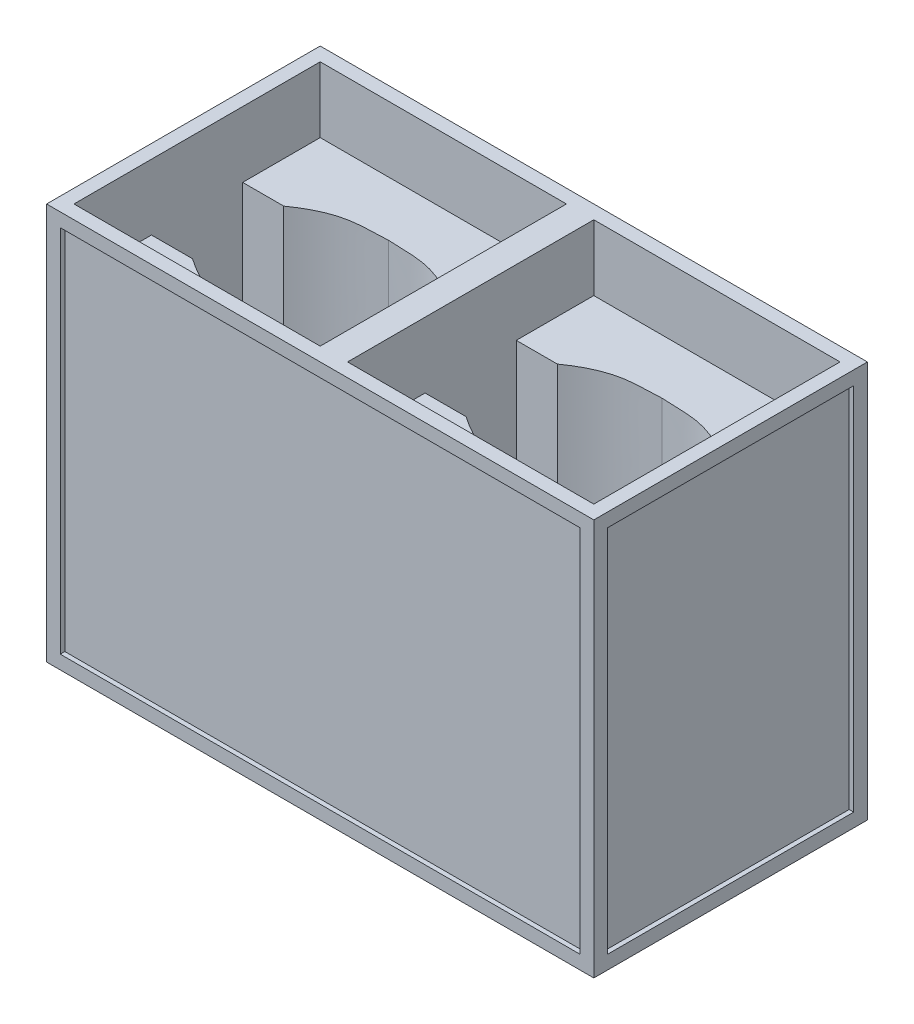
from build123d import *

# Parameters (mm, degrees)
SKETCH1_W           = 120
SKETCH1_H           = 60
BOSS_EXTRUDE1_DEPTH = 87
SKETCH2_W           = 54
SKETCH2_H           = 54
CUT_EXTRUDE1_DEPTH  = 84
BOSS_EXTRUDE2_DEPTH = 69.6
SKETCH6_R           = 5.05
CUT_EXTRUDE2_DEPTH  = 4
SKETCH7_W           = 114
SKETCH7_H           = 81
CUT_EXTRUDE3_DEPTH  = 1
CUT_EXTRUDE4_DEPTH  = 1
SKETCH9_W           = 54
SKETCH9_H           = 81
CUT_EXTRUDE5_DEPTH  = 1
SKETCH10_W          = 54
SKETCH10_H          = 81
CUT_EXTRUDE6_DEPTH  = 1


with BuildPart() as part:
    # Sketch1 → Boss-Extrude1 (new body)
    with BuildSketch(Plane(origin=(0, 0, 0), x_dir=(1, 0, 0), z_dir=(0, 1, 0))):
        with Locations((60, 30)):
            Rectangle(SKETCH1_W, SKETCH1_H)
    extrude(amount=BOSS_EXTRUDE1_DEPTH)

    # Sketch2 → Cut-Extrude1 (cut)
    with BuildSketch(Plane(origin=(0, 87, 0), x_dir=(1, 0, 0), z_dir=(0, 1, 0))):
        with Locations((30, 30)):
            Rectangle(SKETCH2_W, SKETCH2_H)
        with Locations((90, 30)):
            Rectangle(SKETCH2_W, SKETCH2_H)
    extrude(amount=-CUT_EXTRUDE1_DEPTH, mode=Mode.SUBTRACT)

    # Sketch3 → Boss-Extrude2 (add)
    with BuildSketch(Plane(origin=(0, 3, 0), x_dir=(1, 0, 0), z_dir=(0, 1, 0))):
        with BuildLine():
            Line((3, 57), (3, 40))
            Line((3, 40), (12, 40))
            add(Edge.make_bspline(
                [(12, 40), (15.041660356, 42.13868594), (20.58191194, 44.971812716), (26.976295953, 44.853943786), (30, 45)],
                knots=[0.699831651, 0.699831651, 0.699831651, 0.699831651, 1.244465678, 1.699831651, 1.699831651, 1.699831651, 1.699831651], degree=3))
            add(Edge.make_bspline(
                [(30, 45), (33.023704047, 44.853943786), (39.41808806, 44.971812716), (44.958339644, 42.13868594), (48, 40)],
                knots=[0, 0, 0, 0, 0.455365973, 1, 1, 1, 1], degree=3))
            Line((48, 40), (57, 40))
            Line((57, 40), (57, 57))
            Line((57, 57), (3, 57))
        make_face()
        with BuildLine():
            Line((63, 57), (63, 40))
            Line((63, 40), (72, 40))
            add(Edge.make_bspline(
                [(90, 45), (86.976295953, 44.853943786), (80.58191194, 44.971812716), (75.041660356, 42.13868594), (72, 40)],
                knots=[0, 0, 0, 0, 0.455365973, 1, 1, 1, 1], degree=3))
            add(Edge.make_bspline(
                [(90, 45), (93.023704047, 44.853943786), (99.41808806, 44.971812716), (104.958339644, 42.13868594), (108, 40)],
                knots=[0, 0, 0, 0, 0.455365973, 1, 1, 1, 1], degree=3))
            Line((108, 40), (117, 40))
            Line((117, 40), (117, 57))
            Line((117, 57), (63, 57))
        make_face()
        with BuildLine():
            Line((12, 20), (3, 20))
            Line((3, 20), (3, 3))
            Line((3, 3), (57, 3))
            Line((57, 3), (57, 20))
            Line((57, 20), (48, 20))
            add(Edge.make_bspline(
                [(48, 20), (44.958339644, 17.86131406), (39.41808806, 15.028187284), (33.023704047, 15.146056214), (30, 15)],
                knots=[0.699831651, 0.699831651, 0.699831651, 0.699831651, 1.244465678, 1.699831651, 1.699831651, 1.699831651, 1.699831651], degree=3))
            add(Edge.make_bspline(
                [(30, 15), (26.976295953, 15.146056214), (20.58191194, 15.028187284), (15.041660356, 17.86131406), (12, 20)],
                knots=[0, 0, 0, 0, 0.455365973, 1, 1, 1, 1], degree=3))
        make_face()
        with BuildLine():
            Line((72, 20), (63, 20))
            Line((63, 20), (63, 3))
            Line((63, 3), (117, 3))
            Line((117, 3), (117, 20))
            Line((117, 20), (108, 20))
            add(Edge.make_bspline(
                [(90, 15), (93.023704047, 15.146056214), (99.41808806, 15.028187284), (104.958339644, 17.86131406), (108, 20)],
                knots=[0, 0, 0, 0, 0.455365973, 1, 1, 1, 1], degree=3))
            add(Edge.make_bspline(
                [(90, 15), (86.976295953, 15.146056214), (80.58191194, 15.028187284), (75.041660356, 17.86131406), (72, 20)],
                knots=[0, 0, 0, 0, 0.455365973, 1, 1, 1, 1], degree=3))
        make_face()
    extrude(amount=BOSS_EXTRUDE2_DEPTH)

    # Sketch6 → Cut-Extrude2 (cut)
    with BuildSketch(Plane.XZ):
        with Locations((111, -51)):
            Circle(SKETCH6_R)
        with Locations((9, -51)):
            Circle(SKETCH6_R)
        with Locations((9, -9)):
            Circle(SKETCH6_R)
        with Locations((111, -9)):
            Circle(SKETCH6_R)
    extrude(amount=-CUT_EXTRUDE2_DEPTH, mode=Mode.SUBTRACT)

    # Sketch7 → Cut-Extrude3 (cut)
    with BuildSketch(Plane.XY):
        with Locations((60, 43.5)):
            Rectangle(SKETCH7_W, SKETCH7_H)
    extrude(amount=-CUT_EXTRUDE3_DEPTH, mode=Mode.SUBTRACT)

    # Sketch8 → Cut-Extrude4 (cut)
    with BuildSketch(Plane(origin=(0, 0, -60), x_dir=(-1, 0, 0), z_dir=(0, 0, -1))):
        Polygon((-3, 84), (-117, 84), (-117, 83.763999698), (-117, 3), (-3, 3), align=None)
    extrude(amount=-CUT_EXTRUDE4_DEPTH, mode=Mode.SUBTRACT)

    # Sketch9 → Cut-Extrude5 (cut)
    with BuildSketch(Plane.ZY):
        with Locations((-30, 43.5)):
            Rectangle(SKETCH9_W, SKETCH9_H)
    extrude(amount=-CUT_EXTRUDE5_DEPTH, mode=Mode.SUBTRACT)

    # Sketch10 → Cut-Extrude6 (cut)
    with BuildSketch(Plane(origin=(120, 0, 0), x_dir=(0, 0, -1), z_dir=(1, 0, 0))):
        with Locations((30, 43.5)):
            Rectangle(SKETCH10_W, SKETCH10_H)
    extrude(amount=-CUT_EXTRUDE6_DEPTH, mode=Mode.SUBTRACT)


solid = part.part
